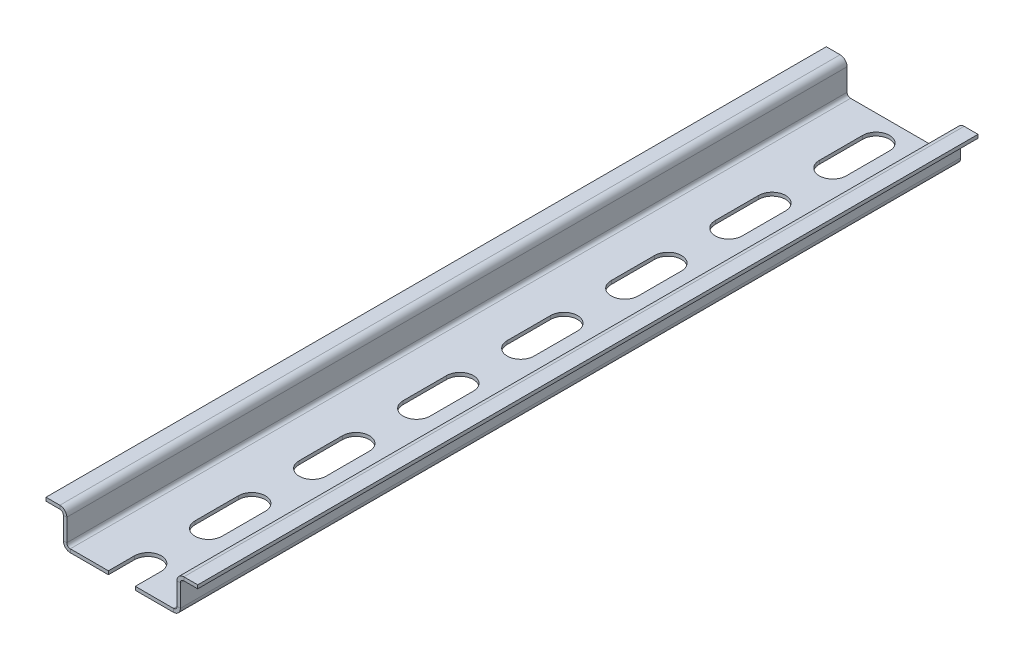
from build123d import *

# Parameters (mm, degrees)
SM_BASE_FLANGE_1_DEPTH = 180
CUT_EXTRUDE_1_DEPTH    = 184.524521522


# Sheet-metal steps are written as plain solids
with BuildPart() as part:
    # Sketch 1 → Базовая кромка1 (new body)
    with BuildSketch(Plane.XY):
        with BuildLine():
            Line((0, 0), (3.2, 0))
            ThreePointArc((3.2, 0), (3.765685425, -0.234314575), (4, -0.8))
            Line((4, -0.8), (4, -5.9))
            ThreePointArc((4, -5.9), (4.46862915, -7.03137085), (5.6, -7.5))
            Line((5.6, -7.5), (29.4, -7.5))
            ThreePointArc((29.4, -7.5), (30.53137085, -7.03137085), (31, -5.9))
            Line((31, -5.9), (31, -0.8))
            ThreePointArc((31, -0.8), (31.234314575, -0.234314575), (31.8, 0))
            Line((31.8, 0), (35, 0))
            Line((35, 0), (35, 0.8))
            Line((35, 0.8), (31.8, 0.8))
            ThreePointArc((31.8, 0.8), (30.66862915, 0.33137085), (30.2, -0.8))
            Line((30.2, -0.8), (30.2, -5.9))
            ThreePointArc((30.2, -5.9), (29.965685425, -6.465685425), (29.4, -6.7))
            Line((29.4, -6.7), (5.6, -6.7))
            ThreePointArc((5.6, -6.7), (5.034314575, -6.465685425), (4.8, -5.9))
            Line((4.8, -5.9), (4.8, -0.8))
            ThreePointArc((4.8, -0.8), (4.33137085, 0.33137085), (3.2, 0.8))
            Line((3.2, 0.8), (0, 0.8))
            Line((0, 0.8), (0, 0))
        make_face()
    extrude(amount=SM_BASE_FLANGE_1_DEPTH)

    # Эскиз6 → Вырез-Вытянуть1 (cut, through all)
    with BuildSketch(Plane(origin=(0, -6.7, 0), x_dir=(1, 0, 0), z_dir=(0, 1, 0))):
        with BuildLine():
            Line((20.6, -6), (20.6, -16))
            ThreePointArc((20.6, -16), (17.5, -19.1), (14.4, -16))
            Line((14.4, -16), (14.4, -6))
            ThreePointArc((14.4, -6), (17.5, -2.9), (20.6, -6))
        make_face()
        with BuildLine():
            Line((20.6, -30), (20.6, -40))
            ThreePointArc((20.6, -40), (17.5, -43.1), (14.4, -40))
            Line((14.4, -40), (14.4, -30))
            ThreePointArc((14.4, -30), (17.5, -26.9), (20.6, -30))
        make_face()
        with BuildLine():
            Line((20.6, -54), (20.6, -64))
            ThreePointArc((20.6, -64), (17.5, -67.1), (14.4, -64))
            Line((14.4, -64), (14.4, -54))
            ThreePointArc((14.4, -54), (17.5, -50.9), (20.6, -54))
        make_face()
        with BuildLine():
            Line((20.6, -78), (20.6, -88))
            ThreePointArc((20.6, -88), (17.5, -91.1), (14.4, -88))
            Line((14.4, -88), (14.4, -78))
            ThreePointArc((14.4, -78), (17.5, -74.9), (20.6, -78))
        make_face()
        with BuildLine():
            Line((20.6, -102), (20.6, -112))
            ThreePointArc((20.6, -112), (17.5, -115.1), (14.4, -112))
            Line((14.4, -112), (14.4, -102))
            ThreePointArc((14.4, -102), (17.5, -98.9), (20.6, -102))
        make_face()
        with BuildLine():
            Line((20.6, -126), (20.6, -136))
            ThreePointArc((20.6, -136), (17.5, -139.1), (14.4, -136))
            Line((14.4, -136), (14.4, -126))
            ThreePointArc((14.4, -126), (17.5, -122.9), (20.6, -126))
        make_face()
        with BuildLine():
            Line((20.6, -150), (20.6, -160))
            ThreePointArc((20.6, -160), (17.5, -163.1), (14.4, -160))
            Line((14.4, -160), (14.4, -150))
            ThreePointArc((14.4, -150), (17.5, -146.9), (20.6, -150))
        make_face()
        with BuildLine():
            Line((20.6, -174), (20.6, -184))
            ThreePointArc((20.6, -184), (17.5, -187.1), (14.4, -184))
            Line((14.4, -184), (14.4, -174))
            ThreePointArc((14.4, -174), (17.5, -170.9), (20.6, -174))
        make_face()
    extrude(amount=-CUT_EXTRUDE_1_DEPTH, mode=Mode.SUBTRACT)


solid = part.part
